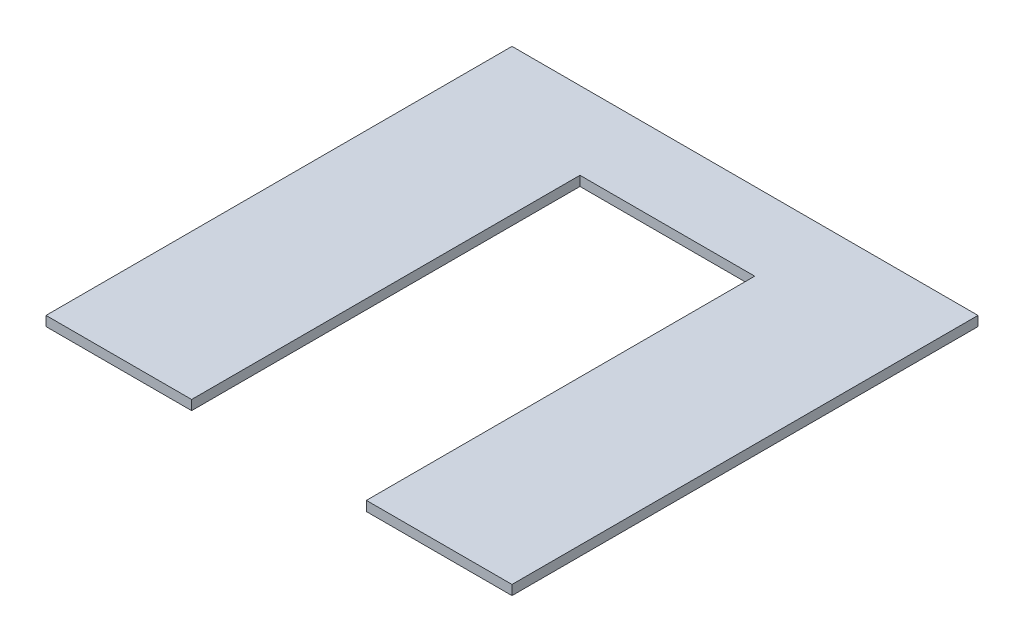
from build123d import *

# Parameters (mm, degrees)
BOSS_EXTRUDE1_DEPTH = 6.35


with BuildPart() as part:
    # Sketch1 → Boss-Extrude1 (new body)
    with BuildSketch(Plane(origin=(0, 0, 0), x_dir=(1, 0, 0), z_dir=(0, 1, 0))):
        Polygon((-152.4, 25.4), (-152.4, -279.4), (-57.15, -279.4), (-57.15, -25.4), (57.15, -25.4), (57.15, -279.4), (152.4, -279.4), (152.4, 25.4), align=None)
    extrude(amount=BOSS_EXTRUDE1_DEPTH)


solid = part.part
